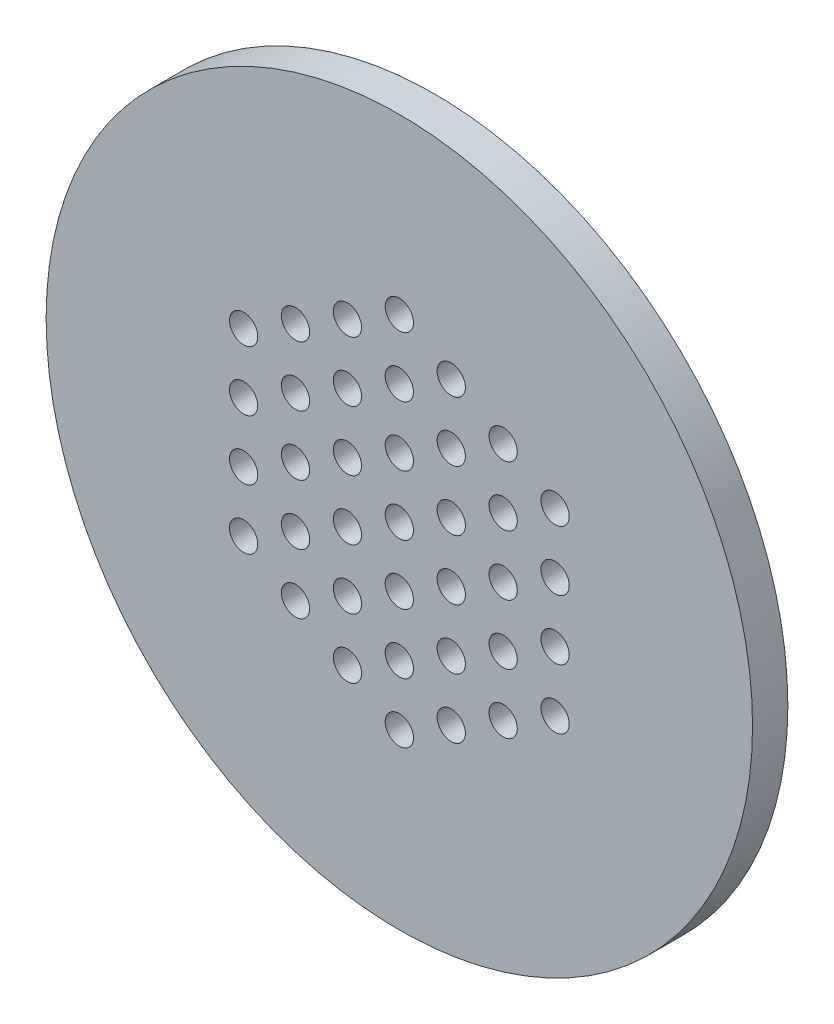
from build123d import *

# Parameters (mm, degrees)
SKETCH1_R               = 100
BOSS_EXTRUDE1_DEPTH     = 10
FILL_PATTERN1_OUTLINE_R = 4
FILL_PATTERN1_DEPTH     = 10


# Read off the part's stored shape, not the designer's step: Fill Pattern1
with BuildPart() as part:
    # Sketch1 → Boss-Extrude1 (new body)
    with BuildSketch(Plane.XY):
        Circle(SKETCH1_R)
    extrude(amount=BOSS_EXTRUDE1_DEPTH)

    # Fill Pattern1 outline → Fill Pattern1 (cut)
    with BuildSketch(Plane.XY):
        with Locations((-44.09081537, 25.455844123)):
            Circle(FILL_PATTERN1_OUTLINE_R)
        with Locations((0, 50.911688245)):
            Circle(FILL_PATTERN1_OUTLINE_R)
        with Locations((-14.696938457, 42.426406871)):
            Circle(FILL_PATTERN1_OUTLINE_R)
        with Locations((-29.393876913, 33.941125497)):
            Circle(FILL_PATTERN1_OUTLINE_R)
        with Locations((-29.393876913, 16.970562748)):
            Circle(FILL_PATTERN1_OUTLINE_R)
        with Locations((-44.09081537, 8.485281374)):
            Circle(FILL_PATTERN1_OUTLINE_R)
        with Locations((-44.09081537, -8.485281374)):
            Circle(FILL_PATTERN1_OUTLINE_R)
        with Locations((-44.09081537, -25.455844123)):
            Circle(FILL_PATTERN1_OUTLINE_R)
        with Locations((14.696938457, 42.426406871)):
            Circle(FILL_PATTERN1_OUTLINE_R)
        with Locations((0, 33.941125497)):
            Circle(FILL_PATTERN1_OUTLINE_R)
        with Locations((-14.696938457, 25.455844123)):
            Circle(FILL_PATTERN1_OUTLINE_R)
        with Locations((-14.696938457, 8.485281374)):
            Circle(FILL_PATTERN1_OUTLINE_R)
        with Locations((-29.393876913, 0)):
            Circle(FILL_PATTERN1_OUTLINE_R)
        with Locations((-29.393876913, -16.970562748)):
            Circle(FILL_PATTERN1_OUTLINE_R)
        with Locations((-29.393876913, -33.941125497)):
            Circle(FILL_PATTERN1_OUTLINE_R)
        with Locations((29.393876913, 33.941125497)):
            Circle(FILL_PATTERN1_OUTLINE_R)
        with Locations((14.696938457, 25.455844123)):
            Circle(FILL_PATTERN1_OUTLINE_R)
        with Locations((0, 16.970562748)):
            Circle(FILL_PATTERN1_OUTLINE_R)
        Circle(FILL_PATTERN1_OUTLINE_R)
        with Locations((-14.696938457, -8.485281374)):
            Circle(FILL_PATTERN1_OUTLINE_R)
        with Locations((-14.696938457, -25.455844123)):
            Circle(FILL_PATTERN1_OUTLINE_R)
        with Locations((-14.696938457, -42.426406871)):
            Circle(FILL_PATTERN1_OUTLINE_R)
        with Locations((44.09081537, 25.455844123)):
            Circle(FILL_PATTERN1_OUTLINE_R)
        with Locations((29.393876913, 16.970562748)):
            Circle(FILL_PATTERN1_OUTLINE_R)
        with Locations((14.696938457, 8.485281374)):
            Circle(FILL_PATTERN1_OUTLINE_R)
        with Locations((14.696938457, -8.485281374)):
            Circle(FILL_PATTERN1_OUTLINE_R)
        with Locations((0, -16.970562748)):
            Circle(FILL_PATTERN1_OUTLINE_R)
        with Locations((0, -33.941125497)):
            Circle(FILL_PATTERN1_OUTLINE_R)
        with Locations((0, -50.911688245)):
            Circle(FILL_PATTERN1_OUTLINE_R)
        with Locations((44.09081537, 8.485281374)):
            Circle(FILL_PATTERN1_OUTLINE_R)
        with Locations((29.393876913, 0)):
            Circle(FILL_PATTERN1_OUTLINE_R)
        with Locations((29.393876913, -16.970562748)):
            Circle(FILL_PATTERN1_OUTLINE_R)
        with Locations((14.696938457, -25.455844123)):
            Circle(FILL_PATTERN1_OUTLINE_R)
        with Locations((14.696938457, -42.426406871)):
            Circle(FILL_PATTERN1_OUTLINE_R)
        with Locations((44.09081537, -8.485281374)):
            Circle(FILL_PATTERN1_OUTLINE_R)
        with Locations((44.09081537, -25.455844123)):
            Circle(FILL_PATTERN1_OUTLINE_R)
        with Locations((29.393876913, -33.941125497)):
            Circle(FILL_PATTERN1_OUTLINE_R)
    extrude(amount=FILL_PATTERN1_DEPTH, mode=Mode.SUBTRACT)


solid = part.part
